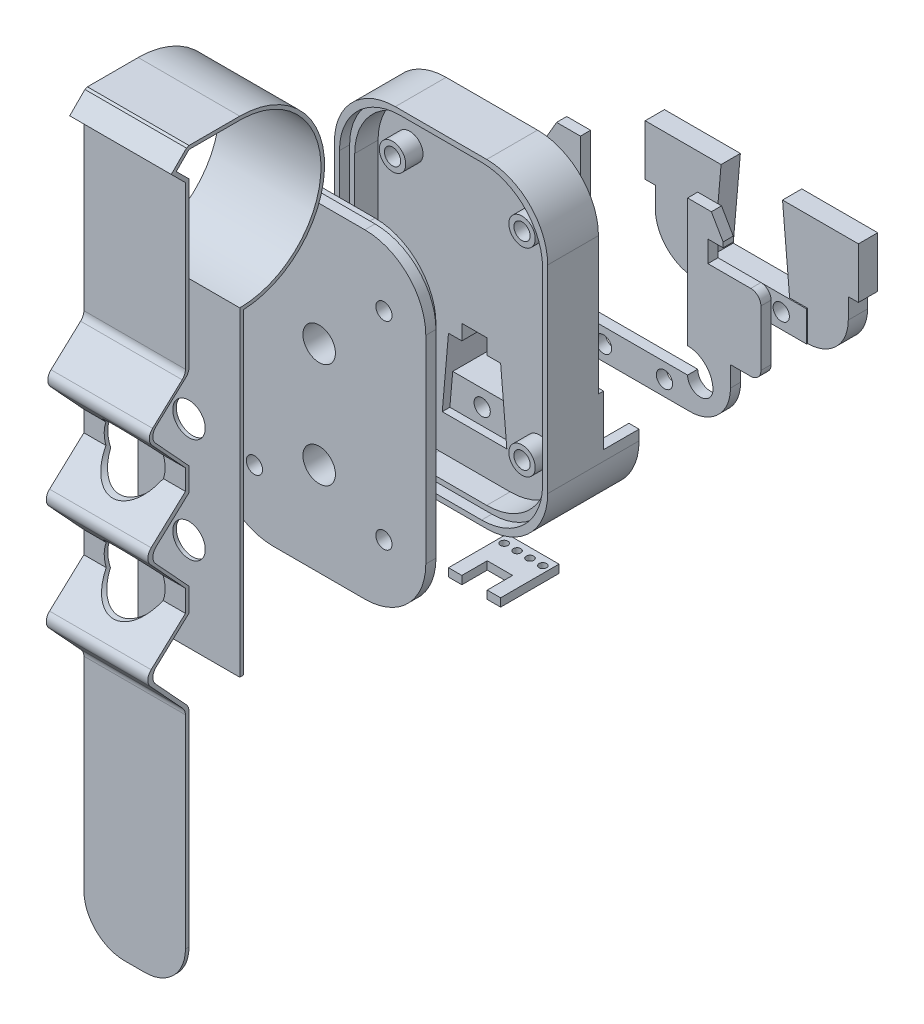
from build123d import *

# Parameters (mm, degrees)
SKETCH_2_W               = 42
SKETCH_2_H               = 63
EXTRUDE_1_DEPTH          = 10
SKETCH_3_W               = 42
SKETCH_3_H               = 24
EXTRUDE_2_DEPTH          = 8
EXTRUDE_3_DEPTH          = 32
SKETCH_5_R               = 0.74
CUT_EXTRUDE_1_DEPTH      = 10
CUT_EXTRUDE_2_DEPTH      = 7
CUT_EXTRUDE_3_DEPTH      = 7
SKETCH_8_R               = 1.6
CUT_EXTRUDE_4_DEPTH      = 3
FILLET_6_R               = 12
EXTRUDE_START            = -30
SKETCH_10_R              = 1.6
EXTRUDE_7951_DEPTH       = 2
EXTRUDE_START_2          = 50
SKETCH_11_W              = 22
SKETCH_11_H              = 6
EXTRUDE_6_DEPTH          = 0.2
EXTRUDE_START_3          = 3.8
SKETCH_12_W              = 22
SKETCH_12_H              = 6
SKETCH_12_R              = 1.64645215
SKETCH_12_R_2            = 1.6
EXTRUDE_7_DEPTH          = 3.8
CHAMFER_2_SIZE           = 1
SKETCH_25_R              = 1.64645215
SKETCH_25_R_2            = 1.6
CUT_EXTRUDE_12_DEPTH     = 4.2
CHAMFER_9960_SIZE        = 1.5
CHAMFER_9960_SIZE_2      = 17.145078454
EXTRUDE_10396_DEPTH      = 3.8
CUT_EXTRUDE_5_DEPTH      = 6.6
CUT_EXTRUDE_6_DEPTH      = 2
EXTRUDE_START_4          = 20
SKETCH_16_W              = 42
SKETCH_16_H              = 63
EXTRUDE_9_DEPTH          = 4
EXTRUDE_10_DEPTH         = 1
SKETCH_20_W              = 42
SKETCH_20_H              = 63
CUT_EXTRUDE_7_DEPTH      = 2
EXTRUDE_11_DEPTH         = 10
EXTRUDE_11_DEPTH_BACK    = 10
FILLET_3_R               = 2
FILLET_4_R               = 2
CUT_EXTRUDE_8_DEPTH      = 12
CUT_EXTRUDE_8_DEPTH_BACK = 8
SKETCH_22_R              = 6
SKETCH_23_R              = 3.2
CUT_EXTRUDE_10_DEPTH     = 0.7
SKETCH_24_R              = 3.2
CUT_EXTRUDE_11_DEPTH     = 6
FILLET_5_R               = 8
FILLET_7_R               = 12
SKETCH_27_R              = 1.6
CUT_EXTRUDE_13_DEPTH     = 6
SKETCH_28_R              = 1.6
CUT_EXTRUDE_14_DEPTH     = 2
SKETCH_29_R              = 2.6
EXTRUDE_12_DEPTH         = 3.4
SKETCH_32_R              = 1.6
CUT_EXTRUDE_16_DEPTH     = 2.4
EXTRUDE_13_DEPTH         = 1
CUT_EXTRUDE_17_DEPTH     = 11.5
SKETCH_38_W              = 5
SKETCH_38_H              = 5
CUT_EXTRUDE_19_DEPTH     = 3
EXTRUDE_15_DEPTH         = 10
SKETCH_40_R              = 1.6
CUT_EXTRUDE_20_DEPTH     = 10.4
EXTRUDE_START_5          = 40
SKETCH_42_R              = 0.74
EXTRUDE_17_DEPTH         = 1.6
FILLET_9_R               = 2


with BuildPart() as part:
    # 草图2 → 凸台-拉伸1 (new body)
    with BuildSketch(Plane.XY):
        Rectangle(SKETCH_2_W, SKETCH_2_H)
    extrude(amount=EXTRUDE_1_DEPTH)

    # 草图3 → 凸台-拉伸2 (add)
    with BuildSketch(Plane(origin=(0, 0, 0), x_dir=(-1, 0, 0), z_dir=(0, 0, -1))):
        with Locations((0, -19.5)):
            Rectangle(SKETCH_3_W, SKETCH_3_H)
    extrude(amount=EXTRUDE_2_DEPTH)

    # 草图4 → 凸台-拉伸3 (add)
    with BuildSketch(Plane(origin=(0, -7.5, 0), x_dir=(1, 0, 0), z_dir=(0, 1, 0))):
        Polygon((3.5, 0), (5.5, 3), (-5.5, 3), (-3.5, 0), align=None)
    extrude(amount=EXTRUDE_3_DEPTH)

    # 草图5 → 切除-拉伸1 (cut)
    with BuildSketch(Plane(origin=(0, -7.5, 0), x_dir=(1, 0, 0), z_dir=(0, 1, 0))):
        with Locations(Location((-3.81, 6.25, 0), (0, 0, 270))):
            Circle(SKETCH_5_R)
        with Locations(Location((-1.27, 6.25, 0), (0, 0, 270))):
            Circle(SKETCH_5_R)
        with Locations(Location((1.27, 6.25, 0), (0, 0, 270))):
            Circle(SKETCH_5_R)
        with Locations(Location((3.81, 6.25, 0), (0, 0, 270))):
            Circle(SKETCH_5_R)
    extrude(amount=-CUT_EXTRUDE_1_DEPTH, mode=Mode.SUBTRACT)

    # 草图6 → 切除-拉伸2 (cut)
    with BuildSketch(Plane(origin=(0, 0, -8), x_dir=(-1, 0, 0), z_dir=(0, 0, -1))):
        with BuildLine():
            Line((-17.55, -7.5), (-21, -7.5))
            Line((-21, -7.5), (-21, -17.5))
            Line((-21, -17.5), (-19, -17.5))
            Line((-19, -17.5), (-19, -21.5))
            ThreePointArc((-19, -21.5), (-16.656854249, -27.156854249), (-11, -29.5))
            Line((-11, -29.5), (-9.55, -29.5))
            Line((-9.55, -29.5), (0, -29.5))
            Line((0, -29.5), (9.55, -29.5))
            Line((9.55, -29.5), (11, -29.5))
            ThreePointArc((11, -29.5), (16.656854249, -27.156854249), (19, -21.5))
            Line((19, -21.5), (19, -17.5))
            Line((19, -17.5), (21, -17.5))
            Line((21, -17.5), (21, -7.5))
            Line((21, -7.5), (17.55, -7.5))
            Line((17.55, -7.5), (14.55, -7.5))
            Line((14.55, -7.5), (9.55, -7.5))
            Line((9.55, -7.5), (9.55, -19.5))
            ThreePointArc((9.55, -19.5), (12.378427125, -20.671572875), (13.55, -23.5))
            ThreePointArc((13.55, -23.5), (11.55, -25.5), (9.55, -23.5))
            Line((9.55, -23.5), (0, -23.5))
            Line((0, -23.5), (-9.55, -23.5))
            ThreePointArc((-9.55, -23.5), (-11.55, -25.5), (-13.55, -23.5))
            ThreePointArc((-13.55, -23.5), (-12.378427125, -20.671572875), (-9.55, -19.5))
            Line((-9.55, -19.5), (-9.55, -7.5))
            Line((-9.55, -7.5), (-14.55, -7.5))
            Line((-14.55, -7.5), (-17.55, -7.5))
        make_face()
    extrude(amount=-CUT_EXTRUDE_2_DEPTH, mode=Mode.SUBTRACT)

    # 草图7 → 切除-拉伸3 (cut)
    with BuildSketch(Plane(origin=(0, 0, -8), x_dir=(-1, 0, 0), z_dir=(0, 0, -1))):
        with BuildLine():
            Line((-7.55, -7.5), (-9.55, -7.5))
            Line((-9.55, -7.5), (-9.55, -19.5))
            ThreePointArc((-9.55, -19.5), (-12.378427125, -20.671572875), (-13.55, -23.5))
            ThreePointArc((-13.55, -23.5), (-12.964213562, -24.914213562), (-11.55, -25.5))
            ThreePointArc((-11.55, -25.5), (-10.135786438, -24.914213562), (-9.55, -23.5))
            Line((-9.55, -23.5), (-7.55, -23.5))
            Line((-7.55, -23.5), (-7.55, -7.5))
        make_face()
        with BuildLine():
            Line((9.55, -7.5), (7.55, -7.5))
            Line((7.55, -7.5), (7.55, -23.5))
            Line((7.55, -23.5), (9.55, -23.5))
            ThreePointArc((9.55, -23.5), (10.135786438, -24.914213562), (11.55, -25.5))
            ThreePointArc((11.55, -25.5), (12.964213562, -24.914213562), (13.55, -23.5))
            ThreePointArc((13.55, -23.5), (12.378427125, -20.671572875), (9.55, -19.5))
            Line((9.55, -19.5), (9.55, -7.5))
        make_face()
    extrude(amount=-CUT_EXTRUDE_3_DEPTH, mode=Mode.SUBTRACT)

    # 草图8 → 切除-拉伸4 (cut)
    with BuildSketch(Plane(origin=(0, 0, -1), x_dir=(-1, 0, 0), z_dir=(0, 0, -1))):
        with Locations((-6, -26.5)):
            Circle(SKETCH_8_R)
        with Locations((6, -26.5)):
            Circle(SKETCH_8_R)
    extrude(amount=-CUT_EXTRUDE_4_DEPTH, mode=Mode.SUBTRACT)

    # 圆角6
    fillet_6_edges = [part.edges().sort_by_distance(p)[0] for p in [
        (21, -31.5, 1),
        (-21, -31.5, 1),
        (-21, 31.5, 5),
        (21, 31.5, 5),
    ]]
    fillet(fillet_6_edges, radius=FILLET_6_R)

    # Chamfer 9960
    # the kernel refuses this chamfer: 17.145078454, 1.5 mm, written as the material it takes off along each edge
    with BuildSketch(Plane(origin=(7.55, -7.5, -52.570930251), x_dir=(-0.9159861691531067, 0.4012098427509178, 0), z_dir=(0, 0, 1))) as chamfer_9960_piece_1:
        Polygon((CHAMFER_9960_SIZE * 0.915986169153, CHAMFER_9960_SIZE * 0.401209842751), (-CHAMFER_9960_SIZE_2 * 0.401209842754, CHAMFER_9960_SIZE_2 * 0.915986169161), (0, 0), align=None)
    extrude(amount=51.570930251, mode=Mode.SUBTRACT)
    with BuildSketch(Plane(origin=(-7.55, -7.5, -52.570930251), x_dir=(0.9159861691531067, 0.4012098427509178, 0), z_dir=(0, 0, 1))) as chamfer_9960_piece_2:
        Polygon((CHAMFER_9960_SIZE * 0.915986169153, -CHAMFER_9960_SIZE * 0.401209842751), (-CHAMFER_9960_SIZE_2 * 0.401209842754, -CHAMFER_9960_SIZE_2 * 0.915986169161), (0, 0), align=None)
    extrude(amount=51.570930251, mode=Mode.SUBTRACT)

    # 草图14 → 切除-拉伸5 (cut)
    with BuildSketch(Plane.XY.offset(10)):
        with BuildLine():
            Line((-7, -29.5), (7, -29.5))
            ThreePointArc((7, -29.5), (15.485281374, -25.985281374), (19, -17.5))
            Line((19, -17.5), (19, 17.5))
            ThreePointArc((19, 17.5), (15.485281374, 25.985281374), (7, 29.5))
            Line((7, 29.5), (-7, 29.5))
            ThreePointArc((-7, 29.5), (-15.485281374, 25.985281374), (-19, 17.5))
            Line((-19, 17.5), (-19, -17.5))
            ThreePointArc((-19, -17.5), (-15.485281374, -25.985281374), (-7, -29.5))
        make_face()
    extrude(amount=-CUT_EXTRUDE_5_DEPTH, mode=Mode.SUBTRACT)

    # 草图15 → 切除-拉伸6 (cut)
    with BuildSketch(Plane.XY.offset(10)):
        with BuildLine():
            Line((-8, -30.5), (8, -30.5))
            ThreePointArc((8, -30.5), (16.485281374, -26.985281374), (20, -18.5))
            Line((20, -18.5), (20, 18.5))
            ThreePointArc((20, 18.5), (16.485281374, 26.985281374), (8, 30.5))
            Line((8, 30.5), (-8, 30.5))
            ThreePointArc((-8, 30.5), (-16.485281374, 26.985281374), (-20, 18.5))
            Line((-20, 18.5), (-20, -18.5))
            ThreePointArc((-20, -18.5), (-16.485281374, -26.985281374), (-8, -30.5))
        make_face()
    extrude(amount=-CUT_EXTRUDE_6_DEPTH, mode=Mode.SUBTRACT)

    # 草图28 → 切除-拉伸14 (cut)
    with BuildSketch(Plane.XY.offset(3.4)):
        with Locations((-12.75, 19.525931249)):
            Circle(SKETCH_28_R)
        with Locations((12.75, 19.525931249)):
            Circle(SKETCH_28_R)
        with Locations((12.75, -19.5)):
            Circle(SKETCH_28_R)
        with Locations((-12.75, -19.5)):
            Circle(SKETCH_28_R)
    extrude(amount=-CUT_EXTRUDE_14_DEPTH, mode=Mode.SUBTRACT)

    # 草图29 → 凸台-拉伸12 (add)
    with BuildSketch(Plane.XY.offset(3.4)):
        with Locations(Location((12.75, 19.525931249, 0), (0, 0, 180))):
            Circle(SKETCH_29_R)
        with Locations(Location((-12.75, 19.525931249, 0), (0, 0, 180))):
            Circle(SKETCH_29_R)
        with Locations(Location((-12.75, -19.5, 0), (0, 0, 180))):
            Circle(SKETCH_29_R)
        with Locations(Location((12.75, -19.5, 0), (0, 0, 180))):
            Circle(SKETCH_29_R)
    extrude(amount=EXTRUDE_12_DEPTH)

    # 草图32 → 切除-拉伸16 (cut)
    with BuildSketch(Plane.XY.offset(6.8)):
        with Locations((-12.75, 19.525931249)):
            Circle(SKETCH_32_R)
        with Locations((12.75, 19.525931249)):
            Circle(SKETCH_32_R)
        with Locations((12.75, -19.5)):
            Circle(SKETCH_32_R)
        with Locations((-12.75, -19.5)):
            Circle(SKETCH_32_R)
    extrude(amount=-CUT_EXTRUDE_16_DEPTH, mode=Mode.SUBTRACT)

    # 草图35 → 凸台-拉伸13 (add)
    with BuildSketch(Plane(origin=(0, 0, -8), x_dir=(-1, 0, 0), z_dir=(0, 0, -1))):
        Polygon((-6.05, -7.5), (-7.449818616, -23.5), (7.449818616, -23.5), (6.05, -7.5), align=None)
    extrude(amount=EXTRUDE_13_DEPTH)

    # 草图36 → 切除-拉伸17 (cut)
    with BuildSketch(Plane.XY.offset(3.4)):
        Polygon((6.358510115, -22.5), (5.133668826, -8.5), (-5.133668826, -8.5), (-6.358510115, -22.5), align=None)
    extrude(amount=-CUT_EXTRUDE_17_DEPTH, mode=Mode.SUBTRACT)

    # 草图38 → 切除-拉伸19 (cut)
    with BuildSketch(Plane(origin=(0, -8.5, 0), x_dir=(-1, 0, 0), z_dir=(0, -1, 0))):
        with Locations((0, -0.9)):
            Rectangle(SKETCH_38_W, SKETCH_38_H)
    extrude(amount=-CUT_EXTRUDE_19_DEPTH, mode=Mode.SUBTRACT)

    # 草图39 → 凸台-拉伸15 (add)
    with BuildSketch(Plane.XY.offset(-8.1)):
        Polygon((0, -16.1), (5.798582669, -16.1), (6.358510115, -22.5), (-6.358510115, -22.5), (-5.798582669, -16.1), align=None)
    extrude(amount=EXTRUDE_15_DEPTH)

    # 草图40 → 切除-拉伸20 (cut)
    with BuildSketch(Plane.XY.offset(1.9)):
        with Locations((0, -19.3)):
            Circle(SKETCH_40_R)
    extrude(amount=-CUT_EXTRUDE_20_DEPTH, mode=Mode.SUBTRACT)

    # 圆角9
    fillet_9_edges = [part.edges().sort_by_distance(p)[0] for p in [
        (4.5, 24.5, -1.5),
        (-4.5, 24.5, -1.5),
    ]]
    fillet(fillet_9_edges, radius=FILLET_9_R)


with BuildPart() as body_2:
    # 草图10 → Extrude 7951 (new body)
    with BuildSketch(Plane.XY.offset(EXTRUDE_START)):
        with BuildLine():
            Line((23, -2.5), (14.55, -2.5))
            Line((14.55, -2.5), (14.55, 1.7))
            Line((14.55, 1.7), (17.55, 1.7))
            Line((17.55, 1.7), (17.55, 2.7))
            Line((17.55, 2.7), (15.240598923, 6.7))
            Line((15.240598923, 6.7), (10.55, 6.7))
            Line((10.55, 6.7), (10.55, -18.5))
            ThreePointArc((10.55, -18.5), (14.085533906, -19.964466094), (15.55, -23.5))
            ThreePointArc((15.55, -23.5), (13.05, -26), (10.55, -23.5))
            Line((10.55, -23.5), (-10.55, -23.5))
            ThreePointArc((-10.55, -23.5), (-13.05, -26), (-15.55, -23.5))
            ThreePointArc((-15.55, -23.5), (-14.085533906, -19.964466094), (-10.55, -18.5))
            Line((-10.55, -18.5), (-10.55, 6.7))
            Line((-10.55, 6.7), (-15.240598923, 6.7))
            Line((-15.240598923, 6.7), (-17.55, 2.7))
            Line((-17.55, 2.7), (-17.55, 1.7))
            Line((-17.55, 1.7), (-14.55, 1.7))
            Line((-14.55, 1.7), (-14.55, -2.5))
            Line((-14.55, -2.5), (-23, -2.5))
            ThreePointArc((-23, -2.5), (-24.414213562, -3.085786438), (-25, -4.5))
            Line((-25, -4.5), (-25, -15.5))
            ThreePointArc((-25, -15.5), (-24.414213562, -16.914213562), (-23, -17.5))
            Line((-23, -17.5), (-19, -17.5))
            Line((-19, -17.5), (-19, -21.5))
            ThreePointArc((-19, -21.5), (-16.656854249, -27.156854249), (-11, -29.5))
            Line((-11, -29.5), (11, -29.5))
            ThreePointArc((11, -29.5), (16.656854249, -27.156854249), (19, -21.5))
            Line((19, -21.5), (19, -17.5))
            Line((19, -17.5), (23, -17.5))
            ThreePointArc((23, -17.5), (24.414213562, -16.914213562), (25, -15.5))
            Line((25, -15.5), (25, -4.5))
            ThreePointArc((25, -4.5), (24.414213562, -3.085786438), (23, -2.5))
        make_face()
        with Locations((-6, -26.5)):
            Circle(SKETCH_10_R, mode=Mode.SUBTRACT)
        with Locations((6, -26.5)):
            Circle(SKETCH_10_R, mode=Mode.SUBTRACT)
    extrude(amount=EXTRUDE_7951_DEPTH)


with BuildPart() as body_3:
    # 草图11 → 凸台-拉伸6 (new body)
    with BuildSketch(Plane(origin=(0, 0, -1), x_dir=(-1, 0, 0), z_dir=(0, 0, -1)).offset(EXTRUDE_START_2)):
        with Locations((0, -26.5)):
            Rectangle(SKETCH_11_W, SKETCH_11_H)
    extrude(amount=EXTRUDE_6_DEPTH)

    # 草图12 → 凸台-拉伸7 (add)
    # profile 1 of 3: a face of its own
    with BuildSketch(Plane(origin=(0, 0, -51.2), x_dir=(-1, 0, 0), z_dir=(0, 0, -1)).offset(EXTRUDE_START_3)):
        with BuildLine():
            ThreePointArc((-19, -21.5), (-16.656854249, -27.156854249), (-11, -29.5))
            Line((-11, -29.5), (-11, -23.5))
            Line((-11, -23.5), (-7.55, -23.5))
            Line((-7.55, -23.5), (-7.55, -14.282140206))
            Line((-7.55, -14.282140206), (-7.55, -7.5))
            Line((-7.55, -7.5), (-21, -7.5))
            Line((-21, -7.5), (-21, -17.5))
            Line((-21, -17.5), (-19, -17.5))
            Line((-19, -17.5), (-19, -21.5))
        make_face()
    # profile 2 of 3: a face of its own
    with BuildSketch(Plane(origin=(0, 0, -51.2), x_dir=(-1, 0, 0), z_dir=(0, 0, -1)).offset(EXTRUDE_START_3)):
        with Locations((0, -26.5)):
            Rectangle(SKETCH_12_W, SKETCH_12_H)
        with Locations(Location((6, -26.5, 0), (0, 0, 180))):
            Circle(SKETCH_12_R, mode=Mode.SUBTRACT)
        with Locations(Location((-6, -26.5, 0), (0, 0, 180))):
            Circle(SKETCH_12_R_2, mode=Mode.SUBTRACT)
    # profile 3 of 3: a face of its own
    with BuildSketch(Plane(origin=(0, 0, -51.2), x_dir=(-1, 0, 0), z_dir=(0, 0, -1)).offset(EXTRUDE_START_3)):
        with BuildLine():
            Line((11, -23.5), (11, -29.5))
            ThreePointArc((11, -29.5), (16.656854249, -27.156854249), (19, -21.5))
            Line((19, -21.5), (19, -17.5))
            Line((19, -17.5), (21, -17.5))
            Line((21, -17.5), (21, -7.5))
            Line((21, -7.5), (7.55, -7.5))
            Line((7.55, -7.5), (7.55, -23.5))
            Line((7.55, -23.5), (11, -23.5))
        make_face()
    extrude(amount=-EXTRUDE_7_DEPTH)

    # 倒角2
    chamfer_2_edges = [body_3.edges().sort_by_distance(p)[0] for p in [
        (-7.64645215, -26.5, -55),
        (4.4, -26.5, -55),
    ]]
    chamfer(chamfer_2_edges, length=CHAMFER_2_SIZE)

    # 草图25 → 切除-拉伸12 (cut)
    with BuildSketch(Plane(origin=(0, 0, -55), x_dir=(-1, 0, 0), z_dir=(0, 0, -1))):
        with Locations(Location((6, -26.5, 0), (0, 0, 180))):
            Circle(SKETCH_25_R)
        with Locations(Location((-6, -26.5, 0), (0, 0, 180))):
            Circle(SKETCH_25_R_2)
    extrude(amount=-CUT_EXTRUDE_12_DEPTH, mode=Mode.SUBTRACT)

    # 草图13 → Extrude 10396 (add)
    with BuildSketch(Plane(origin=(0, 0, -55), x_dir=(-1, 0, 0), z_dir=(0, 0, -1))):
        Polygon((-6.05, -7.5), (-7.449818616, -23.5), (-7.55, -23.5), (-7.55, -7.5), align=None)
        Polygon((6.05, -7.5), (7.55, -7.5), (7.55, -23.5), (7.449818616, -23.5), align=None)
    extrude(amount=-EXTRUDE_10396_DEPTH)


with BuildPart() as body_4:
    # 草图16 → 凸台-拉伸9 (new body)
    with BuildSketch(Plane.XY.offset(10).offset(EXTRUDE_START_4)):
        Rectangle(SKETCH_16_W, SKETCH_16_H)
    extrude(amount=EXTRUDE_9_DEPTH)

    # 草图19 → 凸台-拉伸10 (add)
    with BuildSketch(Plane(origin=(0, 0, 30), x_dir=(-1, 0, 0), z_dir=(0, 0, -1))):
        with BuildLine():
            Line((-6, -28.5), (6, -28.5))
            ThreePointArc((6, -28.5), (14.485281374, -24.985281374), (18, -16.5))
            Line((18, -16.5), (18, 16.5))
            ThreePointArc((18, 16.5), (14.485281374, 24.985281374), (6, 28.5))
            Line((6, 28.5), (-6, 28.5))
            ThreePointArc((-6, 28.5), (-14.485281374, 24.985281374), (-18, 16.5))
            Line((-18, 16.5), (-18, -16.5))
            ThreePointArc((-18, -16.5), (-14.485281374, -24.985281374), (-6, -28.5))
        make_face()
    extrude(amount=EXTRUDE_10_DEPTH)

    # 草图20 → 切除-拉伸7 (cut)
    with BuildSketch(Plane(origin=(0, 0, 30), x_dir=(-1, 0, 0), z_dir=(0, 0, -1))):
        Rectangle(SKETCH_20_W, SKETCH_20_H)
        with BuildLine():
            Line((-7, -30.5), (7, -30.5))
            ThreePointArc((7, -30.5), (15.485281374, -26.985281374), (19, -18.5))
            Line((19, -18.5), (19, 18.5))
            ThreePointArc((19, 18.5), (15.485281374, 26.985281374), (7, 30.5))
            Line((7, 30.5), (-7, 30.5))
            ThreePointArc((-7, 30.5), (-15.485281374, 26.985281374), (-19, 18.5))
            Line((-19, 18.5), (-19, -18.5))
            ThreePointArc((-19, -18.5), (-15.485281374, -26.985281374), (-7, -30.5))
        make_face(mode=Mode.SUBTRACT)
    extrude(amount=-CUT_EXTRUDE_7_DEPTH, mode=Mode.SUBTRACT)

    # 草图24 → 切除-拉伸11 (cut)
    with BuildSketch(Plane.XY.offset(34)):
        with Locations((0, 7.555855621)):
            Circle(SKETCH_24_R)
        with Locations((0, -13.112379601)):
            Circle(SKETCH_24_R)
    extrude(amount=-CUT_EXTRUDE_11_DEPTH, mode=Mode.SUBTRACT)

    # 圆角7
    fillet_7_edges = [body_4.edges().sort_by_distance(p)[0] for p in [
        (21, -31.5, 33),
        (-21, -31.5, 33),
        (-21, 31.5, 33),
        (21, 31.5, 33),
    ]]
    fillet(fillet_7_edges, radius=FILLET_7_R)

    # 草图27 → 切除-拉伸13 (cut)
    with BuildSketch(Plane.XY.offset(34)):
        with Locations((-12.75, 19.525931249)):
            Circle(SKETCH_27_R)
        with Locations((12.75, 19.525931249)):
            Circle(SKETCH_27_R)
        with Locations((12.75, -19.5)):
            Circle(SKETCH_27_R)
        with Locations((-12.75, -19.5)):
            Circle(SKETCH_27_R)
    extrude(amount=-CUT_EXTRUDE_13_DEPTH, mode=Mode.SUBTRACT)


with BuildPart() as body_5:
    # 草图21 → 凸台-拉伸11 (new, two sides: drawn at the far end of the back side and taken through both)
    with BuildSketch(Plane(origin=(0, 0, 0), x_dir=(0, 0, -1), z_dir=(1, 0, 0)).offset(-EXTRUDE_11_DEPTH_BACK)):
        with BuildLine():
            Line((-59.6372278, -31.5), (-59.6372278, 31.5))
            ThreePointArc((-59.6372278, 31.5), (-43.641058217, 47.14991619), (-58.9372278, 63.484680166))
            Line((-58.9372278, 63.484680166), (-59.6372278, 63.5))
            Line((-59.6372278, 63.5), (-69.6372278, 63.5))
            Line((-69.6372278, 63.5), (-72.1372278, 61))
            Line((-72.1372278, 61), (-69.6372278, 58.5))
            Line((-69.6372278, 58.5), (-69.6372278, 25.5))
            Line((-69.6372278, 25.5), (-77.579345381, 18.179037109))
            Line((-77.579345381, 18.179037109), (-69.6372278, 9.563062324))
            Line((-69.6372278, 9.563062324), (-69.6372278, 4.968468838))
            Line((-69.6372278, 4.968468838), (-77.579345381, -2.352494053))
            Line((-77.579345381, -2.352494053), (-69.6372278, -10.968468838))
            Line((-69.6372278, -10.968468838), (-69.6372278, -15.563062324))
            Line((-69.6372278, -15.563062324), (-77.579345381, -22.884025215))
            Line((-77.579345381, -22.884025215), (-69.6372278, -31.5))
            Line((-69.6372278, -31.5), (-69.6372278, -80.5))
            Line((-69.6372278, -80.5), (-70.3372278, -80.5))
            Line((-70.3372278, -80.5), (-70.3372278, -31.773408119))
            Line((-70.3372278, -31.773408119), (-78.56847611, -22.843771009))
            Line((-78.56847611, -22.843771009), (-70.3372278, -15.256290364))
            Line((-70.3372278, -15.256290364), (-70.3372278, -10.968468838))
            Line((-70.3372278, -10.968468838), (-78.56847611, -2.038831728))
            Line((-78.56847611, -2.038831728), (-70.3372278, 5.548648917))
            Line((-70.3372278, 5.548648917), (-70.3372278, 9.563062324))
            Line((-70.3372278, 9.563062324), (-78.279345381, 18.179037109))
            Line((-78.279345381, 18.179037109), (-70.3372278, 25.5))
            Line((-70.3372278, 25.5), (-70.3372278, 58.210050506))
            Line((-70.3372278, 58.210050506), (-73.127177293, 61))
            Line((-73.127177293, 61), (-70.132202547, 63.994974747))
            Line((-70.132202547, 63.994974747), (-69.6372278, 64.2))
            Line((-69.6372278, 64.2), (-59.6372278, 64.2))
            ThreePointArc((-59.6372278, 64.2), (-42.94089748, 47.850076926), (-58.9372278, 30.814677108))
            Line((-58.9372278, 30.814677108), (-58.9372278, -31.5))
            Line((-58.9372278, -31.5), (-59.6372278, -31.5))
        make_face()
    extrude(amount=EXTRUDE_11_DEPTH + EXTRUDE_11_DEPTH_BACK)

    # 圆角3
    fillet_3_edges = [body_5.edges().sort_by_distance(p)[0] for p in [
        (0, 18.179037109, 77.579345381),
        (0, -2.352494053, 77.579345381),
        (0, -22.884025215, 77.579345381),
    ]]
    fillet(fillet_3_edges, radius=FILLET_3_R)

    # 圆角4
    fillet_4_edges = [body_5.edges().sort_by_distance(p)[0] for p in [
        (0, 25.5, 69.6372278),
        (0, -31.5, 69.6372278),
        (0, -31.773408119, 70.3372278),
        (0, -22.843771009, 78.56847611),
        (0, -2.038831728, 78.56847611),
        (0, 18.179037109, 78.279345381),
        (0, 25.5, 70.3372278),
    ]]
    fillet(fillet_4_edges, radius=FILLET_4_R)

    # 草图22 → 切除-拉伸8 (cut, two sides: drawn at the far end of the back side and taken through both)
    with BuildSketch(Plane.XY.offset(70.3372278).offset(-CUT_EXTRUDE_8_DEPTH_BACK)):
        with Locations(Location((0, 7.555855621, 0), (0, 0, 160.45576938))):
            Circle(SKETCH_22_R)
        with Locations(Location((0, -13.112379601, 0), (0, 0, 159.064395454))):
            Circle(SKETCH_22_R)
    extrude(amount=CUT_EXTRUDE_8_DEPTH + CUT_EXTRUDE_8_DEPTH_BACK, mode=Mode.SUBTRACT)

    # 草图23 → 切除-拉伸10 (cut)
    with BuildSketch(Plane.XY.offset(59.6372278)):
        with Locations((0, 7.555855621)):
            Circle(SKETCH_23_R)
        with Locations((0, -13.112379601)):
            Circle(SKETCH_23_R)
    extrude(amount=-CUT_EXTRUDE_10_DEPTH, mode=Mode.SUBTRACT)

    # 圆角5
    fillet_5_edges = [body_5.edges().sort_by_distance(p)[0] for p in [
        (-10, -80.5, 69.9872278),
        (10, -80.5, 69.9872278),
    ]]
    fillet(fillet_5_edges, radius=FILLET_5_R)


with BuildPart() as body_6:
    # 草图42 → 凸台-拉伸17 (new body)
    with BuildSketch(Plane(origin=(0, -8.5, 0), x_dir=(-1, 0, 0), z_dir=(0, -1, 0)).offset(EXTRUDE_START_5)):
        Polygon((-5.133668826, 8.1), (-5.133668826, -3.4), (-2.5, -3.4), (-2.5, 1.6), (2.5, 1.6), (2.5, -3.4), (5.133668826, -3.4), (5.133668826, 8.1), align=None)
        with Locations(Location((3.81, 6.25, 0), (0, 0, 90))):
            Circle(SKETCH_42_R, mode=Mode.SUBTRACT)
        with Locations(Location((-1.27, 6.25, 0), (0, 0, 90))):
            Circle(SKETCH_42_R, mode=Mode.SUBTRACT)
        with Locations(Location((1.27, 6.25, 0), (0, 0, 90))):
            Circle(SKETCH_42_R, mode=Mode.SUBTRACT)
        with Locations(Location((-3.81, 6.25, 0), (0, 0, 90))):
            Circle(SKETCH_42_R, mode=Mode.SUBTRACT)
    extrude(amount=EXTRUDE_17_DEPTH)


solid = Compound([part.part, body_2.part, body_3.part, body_4.part, body_5.part, body_6.part])
